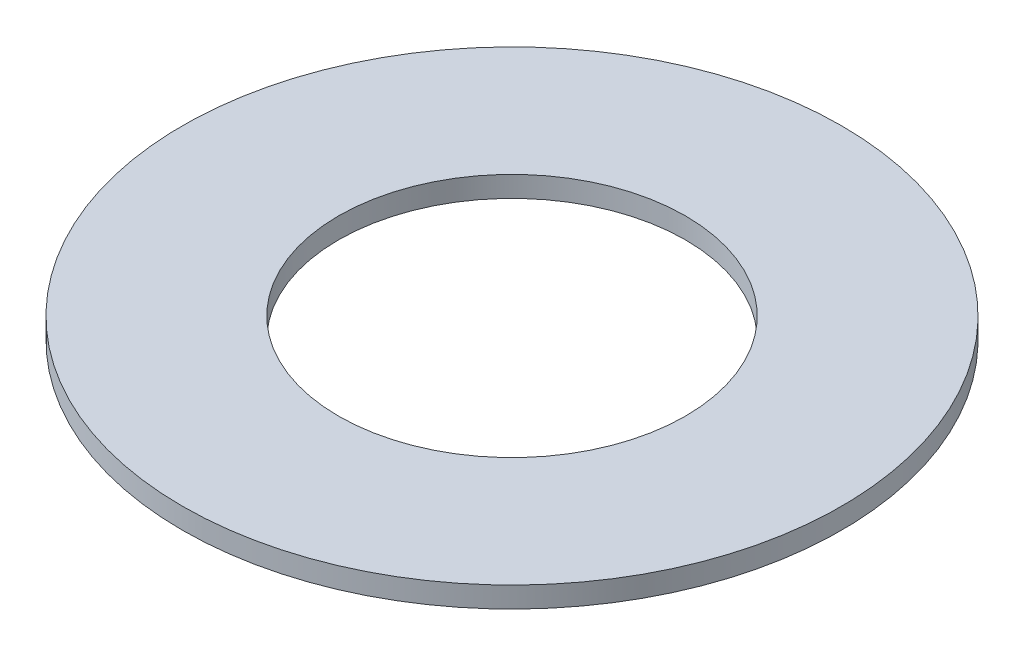
from build123d import *

# Parameters (mm, degrees)
SKETCH1_R           = 95
BOSS_EXTRUDE1_DEPTH = 6
SKETCH2_R           = 50
CUT_EXTRUDE1_DEPTH  = 135.484199815


with BuildPart() as part:
    # Sketch1 → Boss-Extrude1 (new body)
    with BuildSketch(Plane(origin=(0, 0, 0), x_dir=(1, 0, 0), z_dir=(0, 1, 0))):
        Circle(SKETCH1_R)
    extrude(amount=BOSS_EXTRUDE1_DEPTH)

    # Sketch2 → Cut-Extrude1 (cut, through all)
    with BuildSketch(Plane(origin=(0, 0, 0), x_dir=(1, 0, 0), z_dir=(0, 1, 0))):
        Circle(SKETCH2_R)
    extrude(amount=CUT_EXTRUDE1_DEPTH, mode=Mode.SUBTRACT)


solid = part.part
